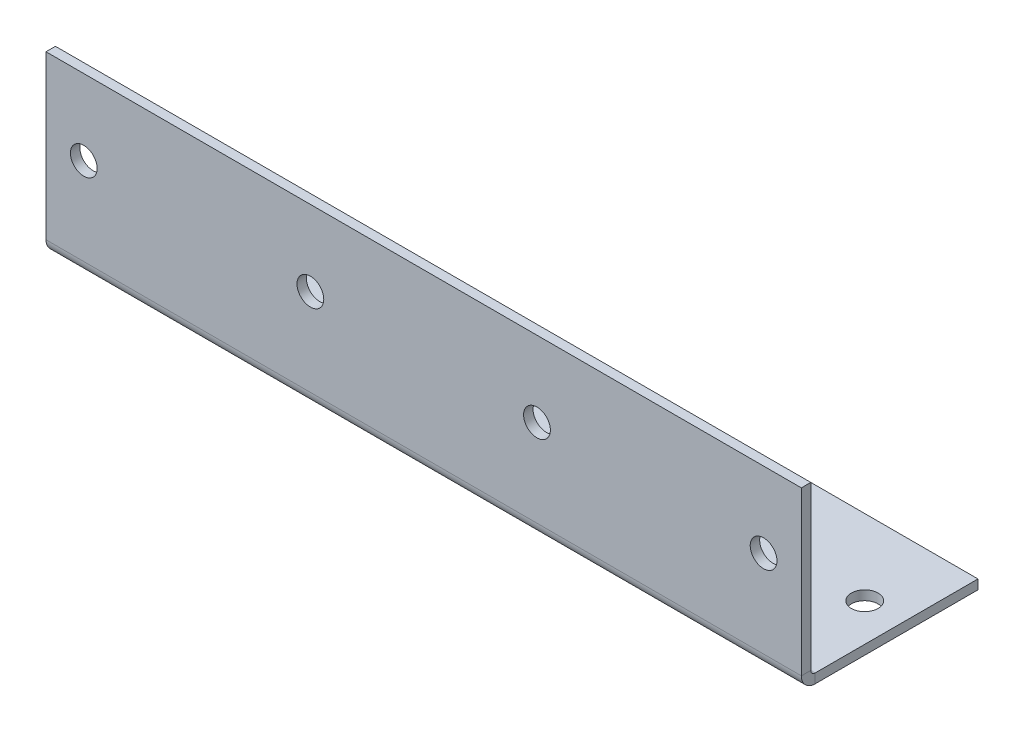
from build123d import *

# Parameters (mm, degrees)
SKETCH1_R                  = 2.25
BASE_FLANGE1_DEPTH         = 1.5875
SKETCHED_START             = -44.45
SKETCHED_BEND1_OUTLINE_W   = 127
SKETCHED_BEND1_OUTLINE_H   = 1.5875
SKETCHED_BEND1_DEPTH       = 27.452834079
SKETCHED_START_2           = -16.777817363
SKETCHED_BEND1_2_OUTLINE_W = 127
SKETCHED_BEND1_2_OUTLINE_H = 28.109665921
SKETCHED_BEND1_2_OUTLINE_R = 2.25
SKETCHED_BEND1_2_DEPTH     = 1.368151442
SKETCHED_START_3           = -16.997165921
SKETCHED_BEND1_3_OUTLINE_W = 127
SKETCHED_BEND1_3_OUTLINE_H = 28.109665921
SKETCHED_BEND1_3_OUTLINE_R = 2.25
SKETCHED_BEND1_3_DEPTH     = 2.3241
SKETCHED_START_4           = -64
SKETCHED_BEND1_4_DEPTH     = 128


with BuildPart() as part:
    # Base-Flange1: sheet metal written as solids
    # Sketch1 → Base-Flange1 (new body)
    with BuildSketch(Plane.XY):
        Polygon((63.5, -12.7), (63.5, 12.7), (-63.5, 12.7), (-63.5, -12.7), (-63.5, -19.05), (-63.5, -44.45), (63.5, -44.45), (63.5, -19.05), align=None)
        with Locations((-57.15, 0)):
            Circle(SKETCH1_R, mode=Mode.SUBTRACT)
        with Locations((-19.05, 0)):
            Circle(SKETCH1_R, mode=Mode.SUBTRACT)
        with Locations((19.05, 0)):
            Circle(SKETCH1_R, mode=Mode.SUBTRACT)
        with Locations((57.15, 0)):
            Circle(SKETCH1_R, mode=Mode.SUBTRACT)
        with Locations(Location((57.15, -31.75, 0), (0, 0, 180))):
            Circle(SKETCH1_R, mode=Mode.SUBTRACT)
        with Locations(Location((19.05, -31.75, 0), (0, 0, 180))):
            Circle(SKETCH1_R, mode=Mode.SUBTRACT)
        with Locations(Location((-19.05, -31.75, 0), (0, 0, 180))):
            Circle(SKETCH1_R, mode=Mode.SUBTRACT)
        with Locations(Location((-57.15, -31.75, 0), (0, 0, 180))):
            Circle(SKETCH1_R, mode=Mode.SUBTRACT)
    extrude(amount=-BASE_FLANGE1_DEPTH)

    # Sketched Bend1: read off the stored shape, not the designer's step
    # Sketched Bend1 outline → Sketched Bend1 (cut)
    with BuildSketch(Plane(origin=(0, 0, 0), x_dir=(1, 0, 0), z_dir=(0, 1, 0)).offset(SKETCHED_START)):
        with Locations((0, 0.79375)):
            Rectangle(SKETCHED_BEND1_OUTLINE_W, SKETCHED_BEND1_OUTLINE_H)
    extrude(amount=SKETCHED_BEND1_DEPTH, mode=Mode.SUBTRACT)

    # Sketched Bend1 2 outline → Sketched Bend1 2 (add)
    with BuildSketch(Plane(origin=(0, 0, 0), x_dir=(1, 0, 0), z_dir=(0, 1, 0)).offset(SKETCHED_START_2)):
        with Locations((0, 15.642332961)):
            Rectangle(SKETCHED_BEND1_2_OUTLINE_W, SKETCHED_BEND1_2_OUTLINE_H)
        with Locations((-57.15, 16.997165921)):
            Circle(SKETCHED_BEND1_2_OUTLINE_R, mode=Mode.SUBTRACT)
        with Locations((-19.05, 16.997165921)):
            Circle(SKETCHED_BEND1_2_OUTLINE_R, mode=Mode.SUBTRACT)
        with Locations((19.05, 16.997165921)):
            Circle(SKETCHED_BEND1_2_OUTLINE_R, mode=Mode.SUBTRACT)
        with Locations((57.15, 16.997165921)):
            Circle(SKETCHED_BEND1_2_OUTLINE_R, mode=Mode.SUBTRACT)
    extrude(amount=SKETCHED_BEND1_2_DEPTH)

    # Sketched Bend1 3 outline → Sketched Bend1 3 (add)
    with BuildSketch(Plane(origin=(0, 0, 0), x_dir=(1, 0, 0), z_dir=(0, 1, 0)).offset(SKETCHED_START_3)):
        with Locations((0, 15.642332961)):
            Rectangle(SKETCHED_BEND1_3_OUTLINE_W, SKETCHED_BEND1_3_OUTLINE_H)
        with Locations((-57.15, 16.997165921)):
            Circle(SKETCHED_BEND1_3_OUTLINE_R, mode=Mode.SUBTRACT)
        with Locations((-19.05, 16.997165921)):
            Circle(SKETCHED_BEND1_3_OUTLINE_R, mode=Mode.SUBTRACT)
        with Locations((19.05, 16.997165921)):
            Circle(SKETCHED_BEND1_3_OUTLINE_R, mode=Mode.SUBTRACT)
        with Locations((57.15, 16.997165921)):
            Circle(SKETCHED_BEND1_3_OUTLINE_R, mode=Mode.SUBTRACT)
    extrude(amount=SKETCHED_BEND1_3_DEPTH)

    # Sketched Bend1 4 outline → Sketched Bend1 4 (cut)
    with BuildSketch(Plane.YZ.offset(SKETCHED_START_4)):
        with BuildLine():
            ThreePointArc((-14.673065921, -1.5875), (-15.193920776, -1.803245145), (-15.409665921, -2.3241))
            Line((-15.409665921, -2.3241), (-15.409665921, -29.697165921))
            Line((-15.409665921, -29.697165921), (-14.673065921, -29.697165921))
            Line((-14.673065921, -29.697165921), (-14.673065921, -1.5875))
        make_face()
        with BuildLine():
            Line((-16.997165921, 0), (-16.997165921, -2.3241))
            ThreePointArc((-16.997165921, -2.3241), (-16.316452791, -0.68071313), (-14.673065921, 0))
            Line((-14.673065921, 0), (-16.997165921, 0))
        make_face()
    extrude(amount=SKETCHED_BEND1_4_DEPTH, mode=Mode.SUBTRACT)


solid = part.part
